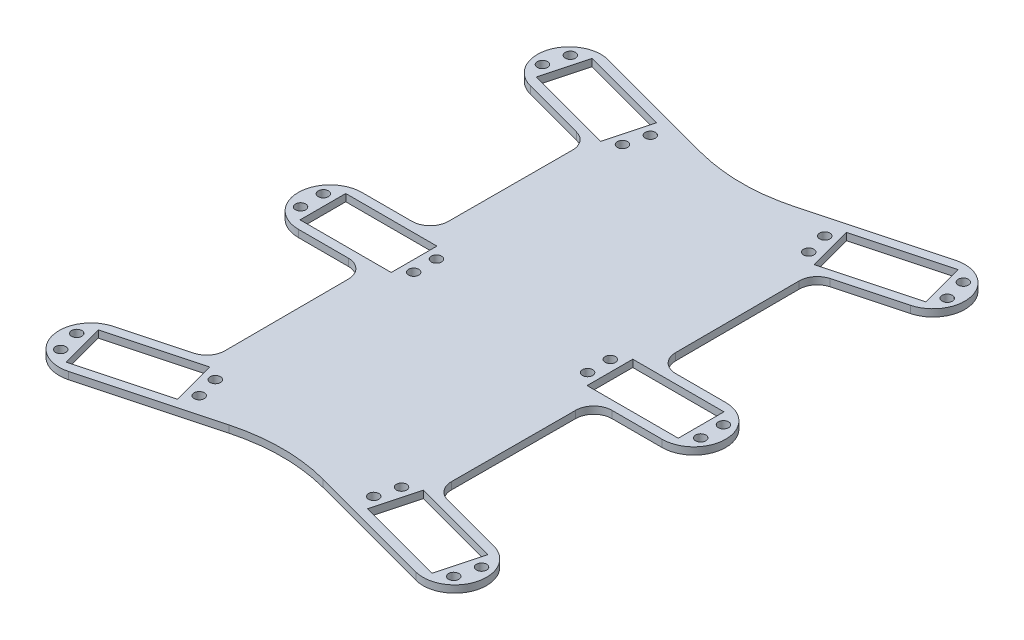
from build123d import *

# Parameters (mm, degrees)
SKETCH1_R           = 2.25
SKETCH1_W           = 40.1
SKETCH1_H           = 20.1
BOSS_EXTRUDE1_DEPTH = 3.175
FILLET1_R           = 80
FILLET2_R           = 8


with BuildPart() as part:
    # Sketch1 → Boss-Extrude1 (new body)
    with BuildSketch(Plane(origin=(0, 0, 0), x_dir=(1, 0, 0), z_dir=(0, 1, 0))):
        with BuildLine():
            Line((-80, 14), (-50, 14))
            Line((-50, 14), (-49.816062711, 82.595931406))
            Line((-49.816062711, 82.595931406), (-83.623466631, 91.654597985))
            ThreePointArc((-83.623466631, 91.654597985), (-93.522961568, 108.801026185), (-76.376533369, 118.700521121))
            Line((-76.376533369, 118.700521121), (0, 98.235490684))
            Line((0, 98.235490684), (76.376533369, 118.700521121))
            ThreePointArc((76.376533369, 118.700521121), (93.522961568, 108.801026185), (83.623466631, 91.654597985))
            Line((83.623466631, 91.654597985), (49.816062711, 82.595931406))
            Line((49.816062711, 82.595931406), (50, 14))
            Line((50, 14), (80, 14))
            ThreePointArc((80, 14), (94, 0), (80, -14))
            Line((80, -14), (50, -14))
            Line((50, -14), (49.816062711, -82.595931406))
            Line((49.816062711, -82.595931406), (83.623466631, -91.654597985))
            ThreePointArc((83.623466631, -91.654597985), (93.522961568, -108.801026185), (76.376533369, -118.700521121))
            Line((76.376533369, -118.700521121), (0, -98.235490684))
            Line((0, -98.235490684), (-76.376533369, -118.700521121))
            ThreePointArc((-76.376533369, -118.700521121), (-93.522961568, -108.801026185), (-83.623466631, -91.654597985))
            Line((-83.623466631, -91.654597985), (-49.816062711, -82.595931406))
            Line((-49.816062711, -82.595931406), (-50, -14))
            Line((-50, -14), (-80, -14))
            ThreePointArc((-80, -14), (-94, 0), (-80, 14))
        make_face()
        with Locations((-86.433311385, 112.077741045)):
            Circle(SKETCH1_R, mode=Mode.SUBTRACT)
        with Locations((-89.021501836, 102.418482782)):
            Circle(SKETCH1_R, mode=Mode.SUBTRACT)
        with Locations((-88, 5)):
            Circle(SKETCH1_R, mode=Mode.SUBTRACT)
        with Locations((-89.021501836, -102.418482782)):
            Circle(SKETCH1_R, mode=Mode.SUBTRACT)
        with Locations((-86.433311385, -112.077741045)):
            Circle(SKETCH1_R, mode=Mode.SUBTRACT)
        with Locations((-88, -5)):
            Circle(SKETCH1_R, mode=Mode.SUBTRACT)
        with Locations((88, -5)):
            Circle(SKETCH1_R, mode=Mode.SUBTRACT)
        with Locations((86.433311385, -112.077741045)):
            Circle(SKETCH1_R, mode=Mode.SUBTRACT)
        with Locations((89.021501836, -102.418482782)):
            Circle(SKETCH1_R, mode=Mode.SUBTRACT)
        with Locations((88, 5)):
            Circle(SKETCH1_R, mode=Mode.SUBTRACT)
        with Locations((89.021501836, 102.418482782)):
            Circle(SKETCH1_R, mode=Mode.SUBTRACT)
        with Locations((86.433311385, 112.077741045)):
            Circle(SKETCH1_R, mode=Mode.SUBTRACT)
        with Locations((-40.95703272, 89.539647098)):
            Circle(SKETCH1_R, mode=Mode.SUBTRACT)
        with Locations((-38.368842269, 99.198905361)):
            Circle(SKETCH1_R, mode=Mode.SUBTRACT)
        with Locations((-38.24, -5)):
            Circle(SKETCH1_R, mode=Mode.SUBTRACT)
        with Locations((-38.24, 5)):
            Circle(SKETCH1_R, mode=Mode.SUBTRACT)
        with Locations((-38.368842269, -99.198905361)):
            Circle(SKETCH1_R, mode=Mode.SUBTRACT)
        with Locations((-40.95703272, -89.539647098)):
            Circle(SKETCH1_R, mode=Mode.SUBTRACT)
        with Locations((38.368842269, 99.198905361)):
            Circle(SKETCH1_R, mode=Mode.SUBTRACT)
        with Locations((40.95703272, 89.539647098)):
            Circle(SKETCH1_R, mode=Mode.SUBTRACT)
        with Locations((38.24, 5)):
            Circle(SKETCH1_R, mode=Mode.SUBTRACT)
        with Locations((38.24, -5)):
            Circle(SKETCH1_R, mode=Mode.SUBTRACT)
        with Locations((40.95703272, -89.539647098)):
            Circle(SKETCH1_R, mode=Mode.SUBTRACT)
        with Locations((38.368842269, -99.198905361)):
            Circle(SKETCH1_R, mode=Mode.SUBTRACT)
        Polygon((-80.460853466, 115.70557048), (-85.663116273, 96.290461372), (-46.929490638, 85.911817663), (-41.727227832, 105.326926772), align=None, mode=Mode.SUBTRACT)
        with Locations((-63.12, 0)):
            Rectangle(SKETCH1_W, SKETCH1_H, mode=Mode.SUBTRACT)
        Polygon((-46.929490638, -85.911817663), (-41.727227832, -105.326926772), (-80.460853466, -115.70557048), (-85.663116273, -96.290461372), align=None, mode=Mode.SUBTRACT)
        Polygon((46.929490638, 85.911817663), (41.727227832, 105.326926772), (80.460853466, 115.70557048), (85.663116273, 96.290461372), align=None, mode=Mode.SUBTRACT)
        with Locations((63.12, 0)):
            Rectangle(SKETCH1_W, SKETCH1_H, mode=Mode.SUBTRACT)
        Polygon((46.929490638, -85.911817663), (41.727227832, -105.326926772), (80.460853466, -115.70557048), (85.663116273, -96.290461372), align=None, mode=Mode.SUBTRACT)
    extrude(amount=BOSS_EXTRUDE1_DEPTH)

    # Fillet1
    fillet1_edges = [part.edges().sort_by_distance(p)[0] for p in [
        (0, 1.5875, -98.235490684),
        (0, 1.5875, 98.235490684),
    ]]
    fillet(fillet1_edges, radius=FILLET1_R)

    # Fillet2
    fillet2_edges = [part.edges().sort_by_distance(p)[0] for p in [
        (49.816062711, 1.5875, 82.595931406),
        (50, 1.5875, 14),
        (50, 1.5875, -14),
        (49.816062711, 1.5875, -82.595931406),
        (-49.816062711, 1.5875, -82.595931406),
        (-50, 1.5875, -14),
        (-50, 1.5875, 14),
        (-49.816062711, 1.5875, 82.595931406),
    ]]
    fillet(fillet2_edges, radius=FILLET2_R)


solid = part.part
